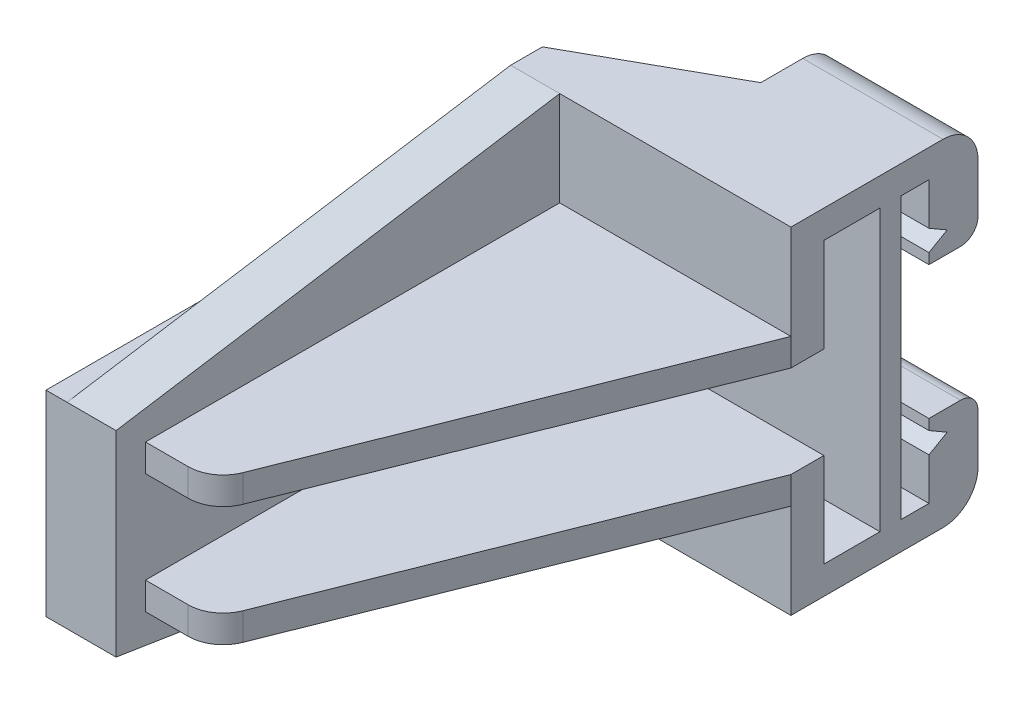
from build123d import *

# Parameters (mm, degrees)
SKETCH_1_W          = 90
SKETCH_1_H          = 48
EXTRUDE_1_DEPTH     = 40
CUT_EXTRUDE_1_DEPTH = 40
CUT_EXTRUDE_2_DEPTH = 110.562767398
CUT_EXTRUDE_3_DEPTH = 110.562767398
CUT_EXTRUDE_4_DEPTH = 33
SKETCH_6_W          = 8
SKETCH_6_H          = 40
CUT_EXTRUDE_5_DEPTH = 110.562767398
SKETCH_7_W          = 20
SKETCH_7_H          = 13.155555556
CUT_EXTRUDE_6_DEPTH = 5
SKETCH_8_W          = 28.2
SKETCH_8_H          = 28
EXTRUDE_2_DEPTH     = 3
SKETCH_9_R          = 2.25
EXTRUDE_3_DEPTH     = 4
SKETCH_10_R         = 1.2
CUT_EXTRUDE_7_DEPTH = 104.889364229
FILLET_1_R          = 5
FILLET_2_R          = 2.5


with BuildPart() as part:
    # 스케치1 → 보스-돌출1 (new body)
    with BuildSketch(Plane(origin=(0, 0, 0), x_dir=(0, 0, -1), z_dir=(1, 0, 0))):
        with Locations((45, 24)):
            Rectangle(SKETCH_1_W, SKETCH_1_H)
    extrude(amount=EXTRUDE_1_DEPTH)

    # 스케치2 → 컷-돌출1 (cut)
    with BuildSketch(Plane(origin=(40, 0, 0), x_dir=(0, 0, -1), z_dir=(1, 0, 0))):
        Polygon((79, 44), (83, 44), (83, 38), (85.598076211, 36.5), (83, 35), (83, 33.5), (90, 33.5), (90, 14.5), (83, 14.5), (83, 13), (85.598076211, 11.5), (83, 10), (83, 4), (79, 4), align=None)
        Polygon((0, 38), (63.304035288, 48), (0, 48), align=None)
        Polygon((0, 10), (63.304035288, 0), (0, 0), align=None)
    extrude(amount=-CUT_EXTRUDE_1_DEPTH, mode=Mode.SUBTRACT)

    # 스케치3 → 컷-돌출2 (cut, through all)
    with BuildSketch(Plane(origin=(0, 48, 0), x_dir=(1, 0, 0), z_dir=(0, 1, 0))):
        Polygon((0, 67.846768337), (20, 79), (20, 90), (0, 90), align=None)
    extrude(amount=-CUT_EXTRUDE_2_DEPTH, mode=Mode.SUBTRACT)

    # 스케치4 → 컷-돌출3 (cut, through all)
    with BuildSketch(Plane(origin=(0, 48, 0), x_dir=(1, 0, 0), z_dir=(0, 1, 0))):
        Polygon((40, 63.304035288), (14.807552651, 0), (40, 0), align=None)
    extrude(amount=-CUT_EXTRUDE_3_DEPTH, mode=Mode.SUBTRACT)

    # 스케치5 → 컷-돌출4 (cut)
    with BuildSketch(Plane(origin=(40, 0, 0), x_dir=(0, 0, -1), z_dir=(1, 0, 0))):
        Polygon((4.2, 34.488888889), (63.304035288, 34.488888889), (63.304035288, 48), (0, 38), (0, 10), (63.304035288, 0), (63.304035288, 13.511111111), (4.2, 13.511111111), (4.2, 17.422222222), (63.304035288, 17.422222222), (63.304035288, 30.577777778), (4.2, 30.577777778), align=None)
    extrude(amount=-CUT_EXTRUDE_4_DEPTH, mode=Mode.SUBTRACT)

    # 스케치6 → 컷-돌출5 (cut, through all)
    with BuildSketch(Plane(origin=(40, 0, 0), x_dir=(0, 0, -1), z_dir=(1, 0, 0))):
        with Locations((72, 24)):
            Rectangle(SKETCH_6_W, SKETCH_6_H)
    extrude(amount=-CUT_EXTRUDE_5_DEPTH, mode=Mode.SUBTRACT)

    # 스케치7 → 컷-돌출6 (cut)
    with BuildSketch(Plane.XY.offset(-63.304035288)):
        with Locations((30, 24)):
            Rectangle(SKETCH_7_W, SKETCH_7_H)
    extrude(amount=-CUT_EXTRUDE_6_DEPTH, mode=Mode.SUBTRACT)

    # 스케치8 → 보스-돌출2 (add)
    with BuildSketch(Plane.ZY):
        with Locations((-14.1, 24)):
            Rectangle(SKETCH_8_W, SKETCH_8_H)
    extrude(amount=EXTRUDE_2_DEPTH)

    # 스케치9 → 보스-돌출3 (add)
    with BuildSketch(Plane(origin=(0, 0, -79), x_dir=(-1, 0, 0), z_dir=(0, 0, -1))):
        with Locations(Location((-30, 24, 0), (0, 0, 180))):
            Circle(SKETCH_9_R)
    extrude(amount=EXTRUDE_3_DEPTH)

    # 스케치10 → 컷-돌출7 (cut, through all)
    with BuildSketch(Plane(origin=(0, 0, -83), x_dir=(-1, 0, 0), z_dir=(0, 0, -1))):
        with Locations((-30, 24)):
            Circle(SKETCH_10_R)
    extrude(amount=-CUT_EXTRUDE_7_DEPTH, mode=Mode.SUBTRACT)

    # 필렛1
    # the kernel refuses this fillet: 5 mm, written as the material it takes off along each edge
    with BuildSketch(Plane(origin=(-3, 49.456439237, -28.2), x_dir=(1, 0, 0), z_dir=(0, -1, 0))) as fillet_1_piece_1:
        with BuildLine():
            CenterArc((5, 4.582575695), FILLET_1_R, 180, 66.421821522)
            Line((0, 4.582575695), (-0.1, 4.582575695))
            Line((-0.1, 4.582575695), (-0.1, 0))
            Line((-0.1, 0), (0, -0.1))
            ThreePointArc((0, -0.1), (1.5, -0.1), (2.96, -0.091651514))
            Line((2.96, -0.091651514), (3, 0))
        make_face()
    extrude(amount=50.912878475, mode=Mode.SUBTRACT)
    with BuildSketch(Plane(origin=(16.47898289, 25.901187913, -4.2), x_dir=(0.36975577982440216, 0, -0.9291289809743576), z_dir=(0, -1, 0)), Plane(origin=(16.47898289, 42.96785458, -4.2), x_dir=(0.36975577982440216, 0, -0.9291289809743576), z_dir=(0, -1, 0))) as fillet_1_piece_2:
        with BuildLine():
            CenterArc((FILLET_1_R * 0.67831725528, -FILLET_1_R), FILLET_1_R, 90, 68.299443615)
            Line((-FILLET_1_R * 0.250811725694, -FILLET_1_R * 0.630244220176), (-FILLET_1_R * 0.269394305314, -FILLET_1_R * 0.622849104579))
            Line((-FILLET_1_R * 0.269394305314, -FILLET_1_R * 0.622849104579), (-FILLET_1_R * 0.0135663451056, FILLET_1_R * 0.02))
            Line((-FILLET_1_R * 0.0135663451056, FILLET_1_R * 0.02), (FILLET_1_R * 0.67831725528, FILLET_1_R * 0.02))
            Line((FILLET_1_R * 0.67831725528, FILLET_1_R * 0.02), (FILLET_1_R * 0.67831725528, 0))
        make_face()
    extrude(amount=20.869042493, mode=Mode.SUBTRACT)
    with BuildSketch(Plane(origin=(7.5, 0, -90), x_dir=(0, 0, 1), z_dir=(1, 0, 0))) as fillet_1_piece_3:
        with BuildLine():
            CenterArc((FILLET_1_R, -FILLET_1_R), FILLET_1_R, 90, 90)
            Line((0, -FILLET_1_R), (-FILLET_1_R * 0.02, -FILLET_1_R))
            Line((-FILLET_1_R * 0.02, -FILLET_1_R), (-FILLET_1_R * 0.02, FILLET_1_R * 0.02))
            Line((-FILLET_1_R * 0.02, FILLET_1_R * 0.02), (FILLET_1_R, FILLET_1_R * 0.02))
            Line((FILLET_1_R, FILLET_1_R * 0.02), (FILLET_1_R, 0))
        make_face()
    extrude(amount=45, mode=Mode.SUBTRACT)
    with BuildSketch(Plane(origin=(7.5, 48, -90), x_dir=(0, 0, 1), z_dir=(1, 0, 0))) as fillet_1_piece_4:
        with BuildLine():
            CenterArc((FILLET_1_R, FILLET_1_R), FILLET_1_R, 180, 90)
            Line((0, FILLET_1_R), (-FILLET_1_R * 0.02, FILLET_1_R))
            Line((-FILLET_1_R * 0.02, FILLET_1_R), (-FILLET_1_R * 0.02, -FILLET_1_R * 0.02))
            Line((-FILLET_1_R * 0.02, -FILLET_1_R * 0.02), (FILLET_1_R, -FILLET_1_R * 0.02))
            Line((FILLET_1_R, -FILLET_1_R * 0.02), (FILLET_1_R, 0))
        make_face()
    extrude(amount=45, mode=Mode.SUBTRACT)

    # 필렛2
    fillet_2_edges = [part.edges().sort_by_distance(p)[0] for p in [
        (30, 14.5, -90),
        (30, 33.5, -90),
    ]]
    fillet(fillet_2_edges, radius=FILLET_2_R)


solid = part.part
